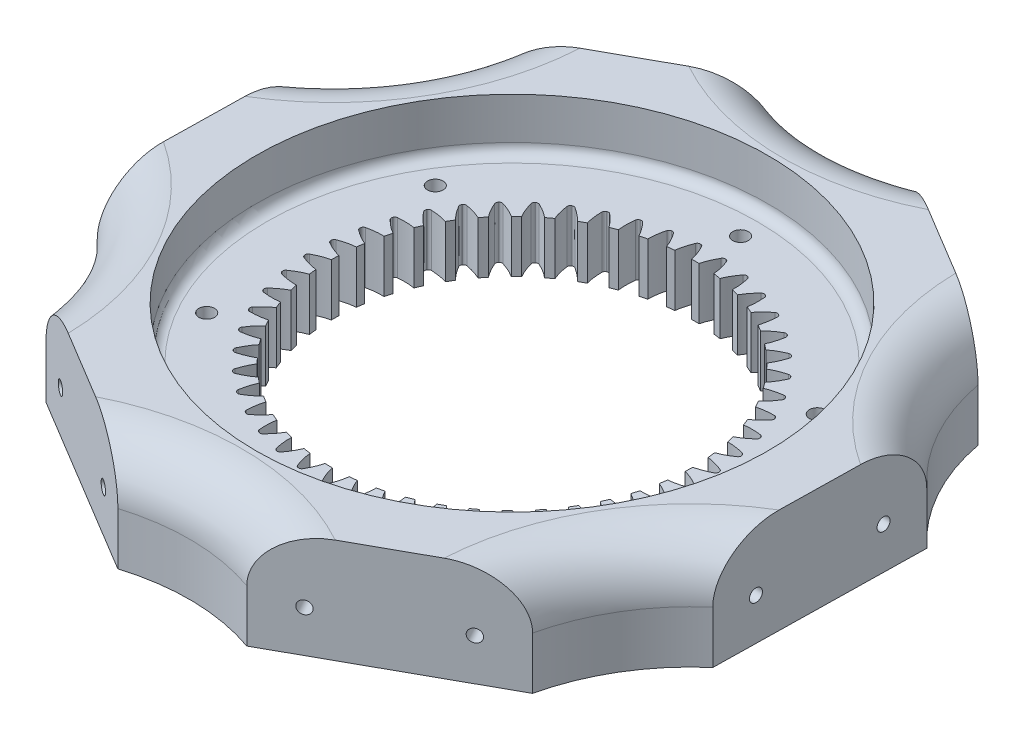
from build123d import *

# Parameters (mm, degrees)
ESQUISSE1_R                        = 37.875
BOSS_EXTRU_1_DEPTH                 = 10
ENL_V_MAT_EXTRU_1_DEPTH            = 55.48881766
CONG_1_R                           = 0.57
R_P_TITION_CIRCULAIRE1_COUNT       = 48
CONG_1_OF_R_P_TITION_CIRCULAIRE1_R = 0.57
ESQUISSE6_R                        = 49
BOSS_EXTRU_2_DEPTH                 = 10
ESQUISSE8_R                        = 49
BOSS_EXTRU_3_DEPTH                 = 20
CONG_2_R                           = 2
ESQUISSE9_R                        = 40
ENL_V_MAT_EXTRU_2_DEPTH            = 95.190110014
CONG_3_R                           = 10
ESQUISSE10_R                       = 1.225
ENL_V_MAT_EXTRU_3_DEPTH            = 15
ESQUISSE13_R                       = 1.5
ENL_V_MAT_EXTRU_5_DEPTH            = 93.583890728
R_P_TITION_CIRCULAIRE2_COUNT       = 6
CONG_3_OF_R_P_TITION_CIRCULAIRE2_R = 10
ESQUISSE11_R                       = 1.5
ENL_V_MAT_EXTRU_4_DEPTH            = 17


with BuildPart() as part:
    # Esquisse1 → Boss.-Extru.1 (new body)
    with BuildSketch(Plane(origin=(0, 0, 0), x_dir=(1, 0, 0), z_dir=(0, 1, 0))):
        with Locations(Location((0, 0, 0), (0, 0, 270))):
            Circle(ESQUISSE1_R)
    extrude(amount=BOSS_EXTRU_1_DEPTH)

    # Esquisse5 → Enlèv. mat.-Extru.1 (cut, symmetric)
    with BuildSketch(Plane(origin=(0, 0, 0), x_dir=(1, 0, 0), z_dir=(0, 1, 0))):
        with BuildLine():
            ThreePointArc((34.499882411, 0.090075817), (34.494522009, -0.61477748), (34.474762535, -1.319374149))
            add(Edge.make_bspline(
                [(34.474762535, -1.319374149), (34.520826847, -1.33044949), (34.649118851, -1.362561439), (34.898849905, -1.431458644), (35.266857715, -1.549463418), (35.70414979, -1.711605562), (36.172996219, -1.909272021), (36.634182074, -2.125315779), (37.087346482, -2.357714243), (37.42746388, -2.546566137), (37.65351257, -2.678422036), (37.768874147, -2.747352489), (37.774960722, -2.750993905)],
                knots=[0.036425064, 0.036425064, 0.036425064, 0.036425064, 0.036425064, 0.046610139, 0.064854849, 0.092110525, 0.119476175, 0.146842495, 0.174208853, 0.201574955, 0.228941013, 0.230465826, 0.230465826, 0.230465826, 0.230465826, 0.230465826], degree=4))
            ThreePointArc((37.774960722, -2.750993905), (37.849981918, -1.376406129), (37.875, 0))
            ThreePointArc((37.875, 0), (37.868499067, 0.701714638), (37.848998499, 1.403188389))
            add(Edge.make_bspline(
                [(34.499882411, 0.090075817), (34.546312122, 0.099502686), (34.675666916, 0.127022734), (34.927694428, 0.186977363), (35.29967346, 0.291793746), (35.742465531, 0.438250619), (36.218057776, 0.619084851), (36.686649162, 0.818557686), (37.147806972, 1.034660671), (37.494437845, 1.211273017), (37.725041478, 1.334990245), (37.842786033, 1.399766172), (37.848998499, 1.403188389)],
                knots=[0.036425064, 0.036425064, 0.036425064, 0.036425064, 0.036425064, 0.046610139, 0.064854849, 0.092110525, 0.119476175, 0.146842495, 0.174208853, 0.201574955, 0.228941013, 0.230465826, 0.230465826, 0.230465826, 0.230465826, 0.230465826], degree=4))
        make_face()
    enl_v_mat_extru_1 = extrude(amount=ENL_V_MAT_EXTRU_1_DEPTH, both=True, mode=Mode.SUBTRACT)

    # Congé1
    cong_1_edges = [part.edges().sort_by_distance(p)[0] for p in [
        (37.774960722, 5, 2.750993905),
        (37.848998499, 5, -1.403188389),
    ]]
    fillet(cong_1_edges, radius=CONG_1_R)

    # Répétition circulaire1: Enlèv. mat.-Extru.1 ×48 about axis
    r_p_tition_circulaire1_axis = Axis((0, 10, 0), (0, 1, 0))
    for i in range(1, R_P_TITION_CIRCULAIRE1_COUNT):
        add(enl_v_mat_extru_1.rotate(r_p_tition_circulaire1_axis, i * 360 / R_P_TITION_CIRCULAIRE1_COUNT), mode=Mode.SUBTRACT)

    # Congé1 of Répétition circulaire1
    cong_1_of_r_p_tition_circulaire1_edges = [part.edges().sort_by_distance(p)[0] for p in [
        (37.810867455, 5, -2.203163013),
        (37.342042232, 5, -6.331469571),
        (37.199819764, 5, -7.119623202),
        (36.19615327, 5, -11.151417553),
        (35.952272842, 5, -11.914264664),
        (34.43093809, 5, -15.78056169),
        (34.089572565, 5, -16.505049753),
        (32.076600013, 5, -20.13969604),
        (31.643590249, 5, -20.813428866),
        (29.173422417, 5, -24.154234608),
        (28.656177331, 5, -24.76568444),
        (25.771079475, 5, -27.755487524),
        (25.178449273, 5, -28.294192287),
        (21.927786217, 5, -30.881836354),
        (21.269910968, 5, -31.33857866),
        (17.709302458, 5, -33.479788402),
        (16.997438589, 5, -33.846753262),
        (13.187807625, 5, -35.504891988),
        (12.434135324, 5, -35.775800533),
        (8.440665746, 5, -36.922497028),
        (7.658080555, 5, -37.092713937),
        (3.549101736, 5, -37.708347907),
        (2.750993905, 5, -37.774960722),
        (-1.403188389, 5, -37.848998499),
        (-2.203163013, 5, -37.810867455),
        (-6.331469571, 5, -37.342042232),
        (-7.119623202, 5, -37.199819764),
        (-11.151417553, 5, -36.19615327),
        (-11.914264664, 5, -35.952272842),
        (-15.78056169, 5, -34.43093809),
        (-16.505049753, 5, -34.089572565),
        (-20.13969604, 5, -32.076600013),
        (-20.813428866, 5, -31.643590249),
        (-24.154234608, 5, -29.173422417),
        (-24.76568444, 5, -28.656177331),
        (-27.755487524, 5, -25.771079475),
        (-28.294192287, 5, -25.178449273),
        (-30.881836354, 5, -21.927786217),
        (-31.33857866, 5, -21.269910968),
        (-33.479788402, 5, -17.709302458),
        (-33.846753262, 5, -16.997438589),
        (-35.504891988, 5, -13.187807625),
        (-35.775800533, 5, -12.434135324),
        (-36.922497028, 5, -8.440665746),
        (-37.092713937, 5, -7.658080555),
        (-37.708347907, 5, -3.549101736),
        (-37.774960722, 5, -2.750993905),
        (-37.848998499, 5, 1.403188389),
        (-37.810867455, 5, 2.203163013),
        (-37.342042232, 5, 6.331469571),
        (-37.199819764, 5, 7.119623202),
        (-36.19615327, 5, 11.151417553),
        (-35.952272842, 5, 11.914264664),
        (-34.43093809, 5, 15.78056169),
        (-34.089572565, 5, 16.505049753),
        (-32.076600013, 5, 20.13969604),
        (-31.643590249, 5, 20.813428866),
        (-29.173422417, 5, 24.154234608),
        (-28.656177331, 5, 24.76568444),
        (-25.771079475, 5, 27.755487524),
        (-25.178449273, 5, 28.294192287),
        (-21.927786217, 5, 30.881836354),
        (-21.269910968, 5, 31.33857866),
        (-17.709302458, 5, 33.479788402),
        (-16.997438589, 5, 33.846753262),
        (-13.187807625, 5, 35.504891988),
        (-12.434135324, 5, 35.775800533),
        (-8.440665746, 5, 36.922497028),
        (-7.658080555, 5, 37.092713937),
        (-3.549101736, 5, 37.708347907),
        (-2.750993905, 5, 37.774960722),
        (1.403188389, 5, 37.848998499),
        (2.203163013, 5, 37.810867455),
        (6.331469571, 5, 37.342042232),
        (7.119623202, 5, 37.199819764),
        (11.151417553, 5, 36.19615327),
        (11.914264664, 5, 35.952272842),
        (15.78056169, 5, 34.43093809),
        (16.505049753, 5, 34.089572565),
        (20.13969604, 5, 32.076600013),
        (20.813428866, 5, 31.643590249),
        (24.154234608, 5, 29.173422417),
        (24.76568444, 5, 28.656177331),
        (27.755487524, 5, 25.771079475),
        (28.294192287, 5, 25.178449273),
        (30.881836354, 5, 21.927786217),
        (31.33857866, 5, 21.269910968),
        (33.479788402, 5, 17.709302458),
        (33.846753262, 5, 16.997438589),
        (35.504891988, 5, 13.187807625),
        (35.775800533, 5, 12.434135324),
        (36.922497028, 5, 8.440665746),
        (37.092713937, 5, 7.658080555),
        (37.708347907, 5, 3.549101736),
    ]]
    fillet(cong_1_of_r_p_tition_circulaire1_edges, radius=CONG_1_OF_R_P_TITION_CIRCULAIRE1_R)


with BuildPart() as body_2:
    # Esquisse6 → Boss.-Extru.2 (new body)
    with BuildSketch(Plane.XZ):
        with Locations(Location((0, 0, 0), (0, 0, 270))):
            Circle(ESQUISSE6_R)
    extrude(amount=-BOSS_EXTRU_2_DEPTH)

    # Combiner1: cut part
    add(part.part, mode=Mode.SUBTRACT)

    # Esquisse8 → Boss.-Extru.3 (add)
    with BuildSketch(Plane(origin=(0, 0, 0), x_dir=(1, 0, 0), z_dir=(0, 1, 0))):
        Polygon((1.234580673, 69.27103154), (-59.373182723, 35.704693995), (-60.607763396, -33.566337544), (-1.234580673, -69.27103154), (59.373182723, -35.704693995), (60.607763396, 33.566337544), align=None)
        with Locations(Location((0, 0, 0), (0, 0, 270))):
            Circle(ESQUISSE8_R, mode=Mode.SUBTRACT)
    extrude(amount=BOSS_EXTRU_3_DEPTH)

    # Congé2
    cong_2_edges = [body_2.edges().sort_by_distance(p)[0] for p in [
        (0, 10, -49),
    ]]
    fillet(cong_2_edges, radius=CONG_2_R)

    # Esquisse9 → Enlèv. mat.-Extru.2 (cut, through all)
    with BuildSketch(Plane(origin=(0, 20, 0), x_dir=(1, 0, 0), z_dir=(0, 1, 0))):
        with Locations((1.781963709, 99.984121766)):
            Circle(ESQUISSE9_R)
    enl_v_mat_extru_2 = extrude(amount=-ENL_V_MAT_EXTRU_2_DEPTH, mode=Mode.SUBTRACT)

    # Congé3
    cong_3_edges = [body_2.edges().sort_by_distance(p)[0] for p in [
        (1.069178225, 20, -59.99047306),
    ]]
    fillet(cong_3_edges, radius=CONG_3_R)

    # Esquisse10 → Enlèv. mat.-Extru.3 (cut)
    with BuildSketch(Plane(origin=(59.99047306, 0, 1.069178225), x_dir=(0.017819637091137923, 0, -0.9998412176610545), z_dir=(0.9998412176610545, 0, 0.017819637091137923))):
        with Locations((-12, 8)):
            Circle(ESQUISSE10_R)
        with Locations(Location((12, 8, 0), (0, 0, 180))):
            Circle(ESQUISSE10_R)
    enl_v_mat_extru_3 = extrude(amount=-ENL_V_MAT_EXTRU_3_DEPTH, mode=Mode.SUBTRACT)

    # Esquisse13 → Enlèv. mat.-Extru.5 (cut, through all)
    with BuildSketch(Plane(origin=(0, 10, 0), x_dir=(1, 0, 0), z_dir=(0, 1, 0))):
        with Locations(Location((0.766244395, 42.993172359, 0), (0, 0, 270))):
            Circle(ESQUISSE13_R)
    enl_v_mat_extru_5 = extrude(amount=-ENL_V_MAT_EXTRU_5_DEPTH, mode=Mode.SUBTRACT)

    # Répétition circulaire2: Enlèv. mat.-Extru.2, Enlèv. mat.-Extru.3, Enlèv. mat.-Extru.5 ×6 about axis
    r_p_tition_circulaire2_axis = Axis((0, 0, 0), (0, 1, 0))
    add([enl_v_mat_extru_2.rotate(r_p_tition_circulaire2_axis, i * 360 / R_P_TITION_CIRCULAIRE2_COUNT) for i in range(1, R_P_TITION_CIRCULAIRE2_COUNT)], mode=Mode.SUBTRACT)
    add([enl_v_mat_extru_3.rotate(r_p_tition_circulaire2_axis, i * 360 / R_P_TITION_CIRCULAIRE2_COUNT) for i in range(1, R_P_TITION_CIRCULAIRE2_COUNT)], mode=Mode.SUBTRACT)
    add([enl_v_mat_extru_5.rotate(r_p_tition_circulaire2_axis, i * 360 / R_P_TITION_CIRCULAIRE2_COUNT) for i in range(1, R_P_TITION_CIRCULAIRE2_COUNT)], mode=Mode.SUBTRACT)

    # Congé3 of Répétition circulaire2
    cong_3_of_r_p_tition_circulaire2_edges = [body_2.edges().sort_by_distance(p)[0] for p in [
        (-51.418684542, 20, -30.921172034),
        (-52.487862767, 20, 29.069301025),
        (-1.069178225, 20, 59.99047306),
        (51.418684542, 20, 30.921172034),
        (52.487862767, 20, -29.069301025),
    ]]
    fillet(cong_3_of_r_p_tition_circulaire2_edges, radius=CONG_3_OF_R_P_TITION_CIRCULAIRE2_R)

    # Esquisse11 → Enlèv. mat.-Extru.4 (cut)
    with BuildSketch(Plane.XZ):
        with Locations(Location((-16.002683857, 55.730728592, 0), (0, 0, 270))):
            Circle(ESQUISSE11_R)
        with Locations(Location((55.730728592, 16.002683857, 0), (0, 0, 90))):
            Circle(ESQUISSE11_R)
        with Locations(Location((16.002683857, -55.730728592, 0), (0, 0, 270))):
            Circle(ESQUISSE11_R)
        with Locations(Location((-55.730728592, -16.002683857, 0), (0, 0, 90))):
            Circle(ESQUISSE11_R)
    extrude(amount=-ENL_V_MAT_EXTRU_4_DEPTH, mode=Mode.SUBTRACT)


solid = body_2.part
